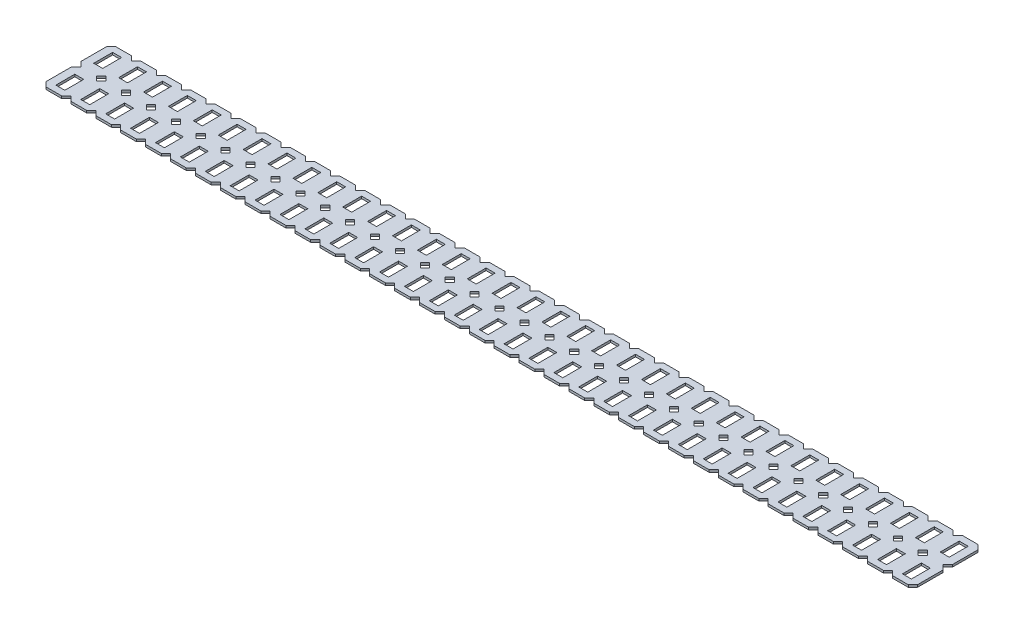
from build123d import *

# Parameters (mm, degrees)
SKETCH2_W            = 444.5
SKETCH2_H            = 35.56
BOSS_EXTRUDE1_DEPTH  = 1.1684
SKETCH3_W            = 4.572
SKETCH3_H            = 9.652
CUT_EXTRUDE1_DEPTH   = 446.921662132
LPATTERN1_COUNT      = 35
LPATTERN1_PITCH      = 12.7
CUT_EXTRUDE2_DEPTH   = 446.921662132
LPATTERN2_COUNT      = 36
LPATTERN2_PITCH      = 12.7
LPATTERN2_COUNT_DIR2 = 3
LPATTERN2_PITCH_DIR2 = 17.78


with BuildPart() as part:
    # Sketch2 → Boss-Extrude1 (new body)
    with BuildSketch(Plane(origin=(0, 0, 0), x_dir=(1, 0, 0), z_dir=(0, 1, 0))):
        with Locations((222.25, 17.78)):
            Rectangle(SKETCH2_W, SKETCH2_H)
    extrude(amount=BOSS_EXTRUDE1_DEPTH)

    # Sketch3 → Cut-Extrude1 (cut, through all)
    with BuildSketch(Plane(origin=(0, 1.1684, 0), x_dir=(1, 0, 0), z_dir=(0, 1, 0))):
        with Locations((6.35, 27.432)):
            Rectangle(SKETCH3_W, SKETCH3_H)
        with Locations((6.35, 8.128)):
            Rectangle(SKETCH3_W, SKETCH3_H)
    cut_extrude1 = extrude(amount=-CUT_EXTRUDE1_DEPTH, mode=Mode.SUBTRACT)

    # LPattern1: Cut-Extrude1 ×35
    with Locations(*[(i * LPATTERN1_PITCH, 0, 0) for i in range(1, LPATTERN1_COUNT)]):
        add(cut_extrude1, mode=Mode.SUBTRACT)

    # Sketch4 → Cut-Extrude2 (cut, through all)
    with BuildSketch(Plane(origin=(0, 1.1684, 0), x_dir=(1, 0, 0), z_dir=(0, 1, 0))):
        Polygon((0, 2.334866591), (2.334866591, 0), (0, -2.334866591), (-2.334866591, 0), align=None)
    cut_extrude2 = extrude(amount=-CUT_EXTRUDE2_DEPTH, mode=Mode.SUBTRACT)

    # LPattern2: Cut-Extrude2 36 × 3
    with Locations(*[(i * LPATTERN2_PITCH, 0, -j * LPATTERN2_PITCH_DIR2) for i in range(LPATTERN2_COUNT) for j in range(LPATTERN2_COUNT_DIR2) if (i, j) != (0, 0)]):
        add(cut_extrude2, mode=Mode.SUBTRACT)


solid = part.part
